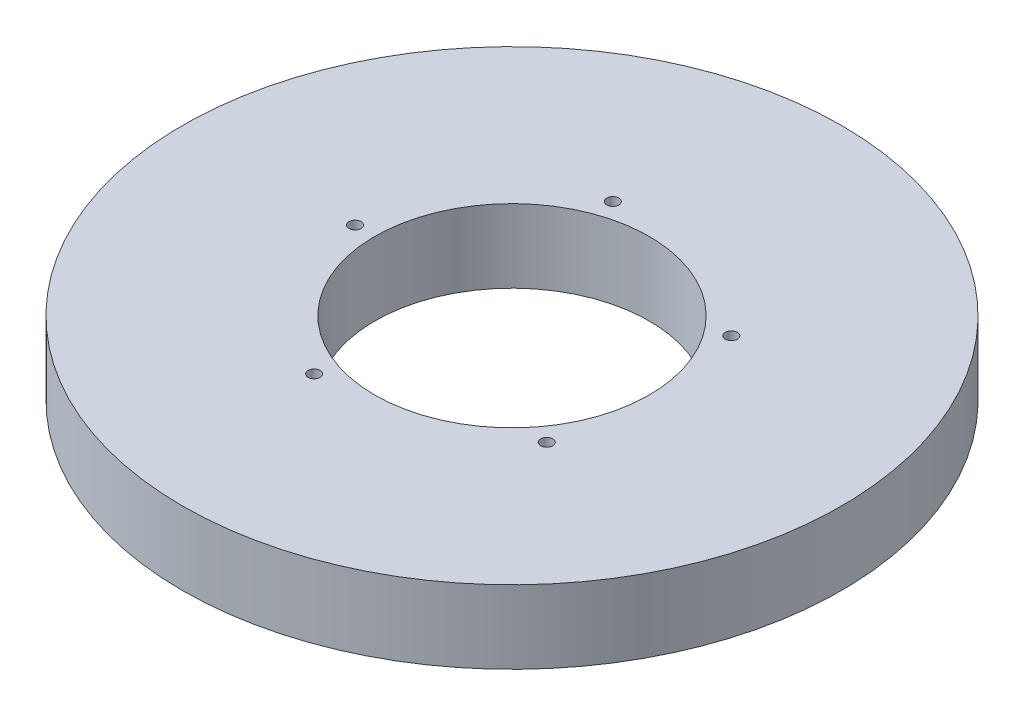
from build123d import *

# Parameters (mm, degrees)
SKETCH1_R           = 90
BOSS_EXTRUDE1_DEPTH = 20
SKETCH2_R           = 37.5
CUT_EXTRUDE1_DEPTH  = 129.840987267
SKETCH3_R           = 1.648240031
CUT_EXTRUDE2_DEPTH  = 19.410813467
CIRPATTERN1_COUNT   = 5


with BuildPart() as part:
    # Sketch1 → Boss-Extrude1 (new body)
    with BuildSketch(Plane(origin=(0, 0, 0), x_dir=(1, 0, 0), z_dir=(0, 1, 0))):
        Circle(SKETCH1_R)
    extrude(amount=BOSS_EXTRUDE1_DEPTH)

    # Sketch2 → Cut-Extrude1 (cut, through all)
    with BuildSketch(Plane(origin=(0, 0, 0), x_dir=(1, 0, 0), z_dir=(0, 1, 0))):
        Circle(SKETCH2_R)
    extrude(amount=CUT_EXTRUDE1_DEPTH, mode=Mode.SUBTRACT)

    # Sketch3 → Cut-Extrude2 (cut)
    with BuildSketch(Plane(origin=(0, 20, 0), x_dir=(1, 0, 0), z_dir=(0, 1, 0))):
        with Locations((-42.874892995, 0)):
            Circle(SKETCH3_R)
    cut_extrude2 = extrude(amount=-CUT_EXTRUDE2_DEPTH, mode=Mode.SUBTRACT)

    # CirPattern1: Cut-Extrude2 ×5 about axis
    cirpattern1_axis = Axis((0, 0, 0), (0, 1, 0))
    for i in range(1, CIRPATTERN1_COUNT):
        add(cut_extrude2.rotate(cirpattern1_axis, i * 360 / CIRPATTERN1_COUNT), mode=Mode.SUBTRACT)


solid = part.part
